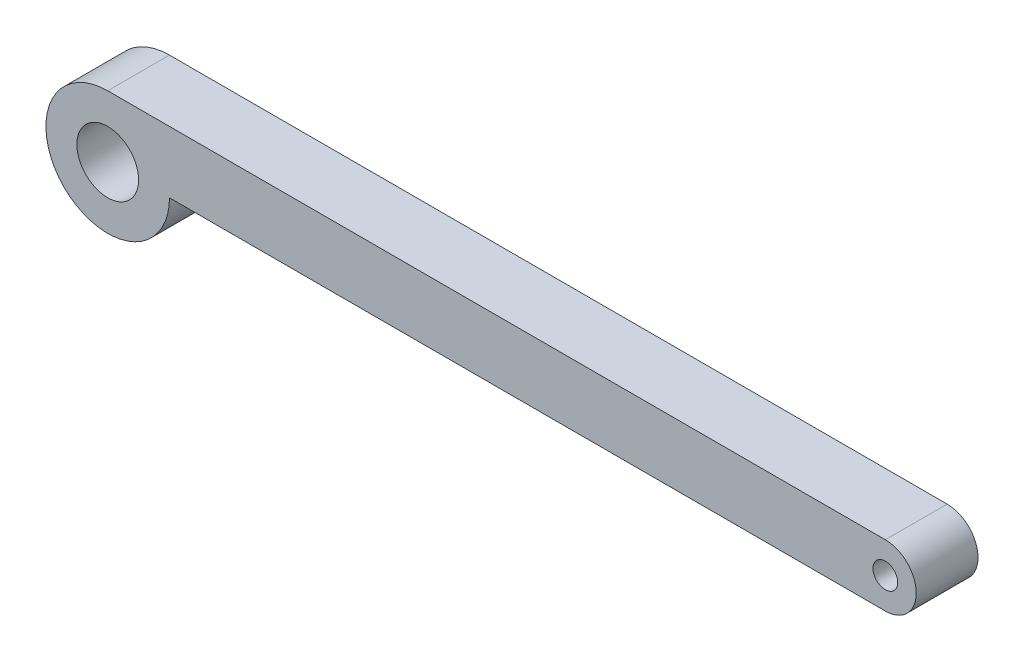
from build123d import *

# Parameters (mm, degrees)
SKETCH1_R           = 2
SKETCH1_R_2         = 5
BOSS_EXTRUDE1_DEPTH = 10


with BuildPart() as part:
    # Sketch1 → Boss-Extrude1 (new body)
    with BuildSketch(Plane(origin=(0, 0, 0), x_dir=(0, 1, 0), z_dir=(0, 0, 1))):
        with BuildLine():
            Line((10, 0), (10, -125.888745105))
            ThreePointArc((10, -125.888745105), (5, -130.888745105), (0, -125.888745105))
            Line((0, -125.888745105), (0, -10))
            ThreePointArc((0, -10), (-7.071067812, 7.071067812), (10, 0))
        make_face()
        with Locations((5, -125.888745105)):
            Circle(SKETCH1_R, mode=Mode.SUBTRACT)
        Circle(SKETCH1_R_2, mode=Mode.SUBTRACT)
    extrude(amount=BOSS_EXTRUDE1_DEPTH)


solid = part.part
